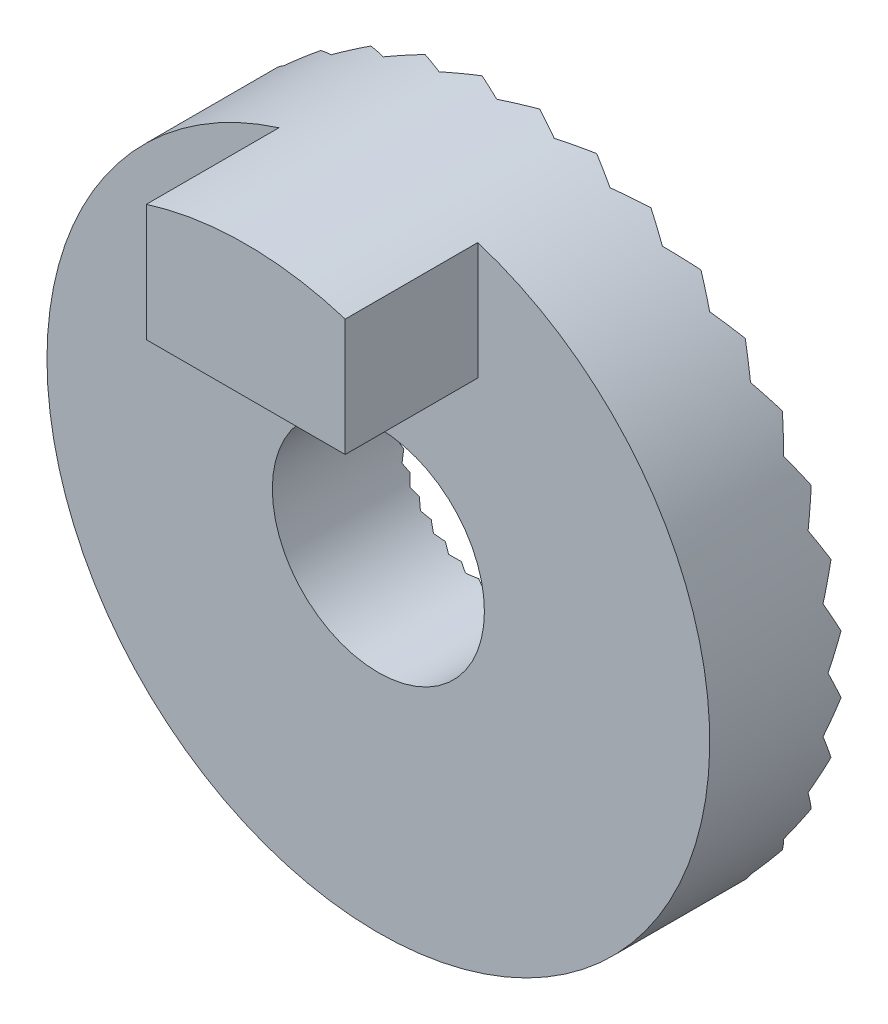
from build123d import *

# Parameters (mm, degrees)
SKETCH_1_R               = 5
SKETCH_1_R_2             = 1.6
EXTRUDE_1_DEPTH          = 2
EXTRUDE_2_DEPTH          = 2
CUT_EXTRUDE_START        = 1.574632158
CUT_EXTRUDE_1_DEPTH      = 3.428926011
PATTERN_CIRCULAR_1_COUNT = 36


# Read off the part's stored shape, not the designer's step: 切除-拉伸1
with BuildPart() as part:
    # 草图1 → 凸台-拉伸1 (new body)
    with BuildSketch(Plane.XY):
        Circle(SKETCH_1_R)
        Circle(SKETCH_1_R_2, mode=Mode.SUBTRACT)
    extrude(amount=EXTRUDE_1_DEPTH)

    # 草图2 → 凸台-拉伸2 (add)
    with BuildSketch(Plane.XY.offset(2)):
        with BuildLine():
            Line((-1.5, 4.769696007), (-1.5, 3))
            Line((-1.5, 3), (1.5, 3))
            Line((1.5, 3), (1.5, 4.769696007))
            ThreePointArc((1.5, 4.769696007), (0, 5), (-1.5, 4.769696007))
        make_face()
    extrude(amount=EXTRUDE_2_DEPTH)

    # 切除-拉伸1 outline → 切除-拉伸1 (cut)
    with BuildSketch(Plane(origin=(0, 0, 0), x_dir=(0, 1, 0), z_dir=(0.9997499284218206, 0, 0.022362482432963404)).offset(CUT_EXTRUDE_START)):
        Polygon((0.436574347, -0.111385374), (0, 0.103160358), (-0.436574347, -0.111385374), (-2, -0.879699645), (-2, -2), (2, -2), (2, -0.879699645), align=None)
    cut_extrude_1 = extrude(amount=CUT_EXTRUDE_1_DEPTH, mode=Mode.SUBTRACT)

    # 阵列(圆周)1: 切除-拉伸1 ×36 about axis
    pattern_circular_1_axis = Axis((0, 0, 0), (0, 0, 1))
    for i in range(1, PATTERN_CIRCULAR_1_COUNT):
        add(cut_extrude_1.rotate(pattern_circular_1_axis, i * 360 / PATTERN_CIRCULAR_1_COUNT), mode=Mode.SUBTRACT)


solid = part.part
